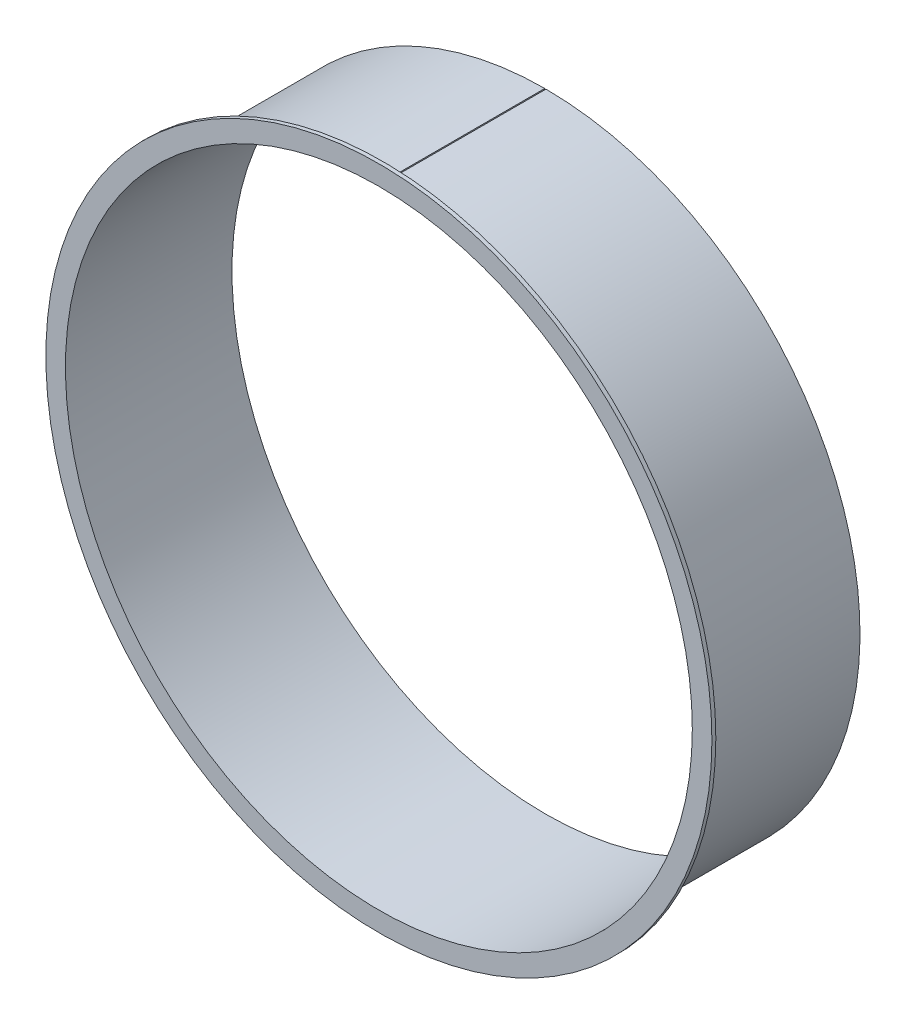
from build123d import *

# Parameters (mm, degrees)
BASE_FLANGE1_DEPTH  = 207.5
EXTRUDE_THIN1_START = 10
SKETCH5_R           = 850
SKETCH5_R_2         = 800
EXTRUDE_THIN1_DEPTH = 10


# Sheet-metal steps are written as plain solids
with BuildPart() as part:
    # Sketch2 → Base-Flange1 (new, symmetric)
    with BuildSketch(Plane.XY):
        with BuildLine():
            ThreePointArc((-1.5, 799.998593749), (0, -800), (1.5, 799.998593749))
            Line((1.5, 799.998593749), (1.505625, 802.998588475))
            ThreePointArc((1.505625, 802.998588475), (0, -803), (-1.505625, 802.998588475))
            Line((-1.505625, 802.998588475), (-1.5, 799.998593749))
        make_face()
    extrude(amount=BASE_FLANGE1_DEPTH, both=True)

    # Sketch5 → Extrude-Thin1 (add)
    with BuildSketch(Plane.XY.offset(207.5).offset(EXTRUDE_THIN1_START)):
        Circle(SKETCH5_R)
        Circle(SKETCH5_R_2, mode=Mode.SUBTRACT)
    extrude(amount=-EXTRUDE_THIN1_DEPTH)


solid = part.part
